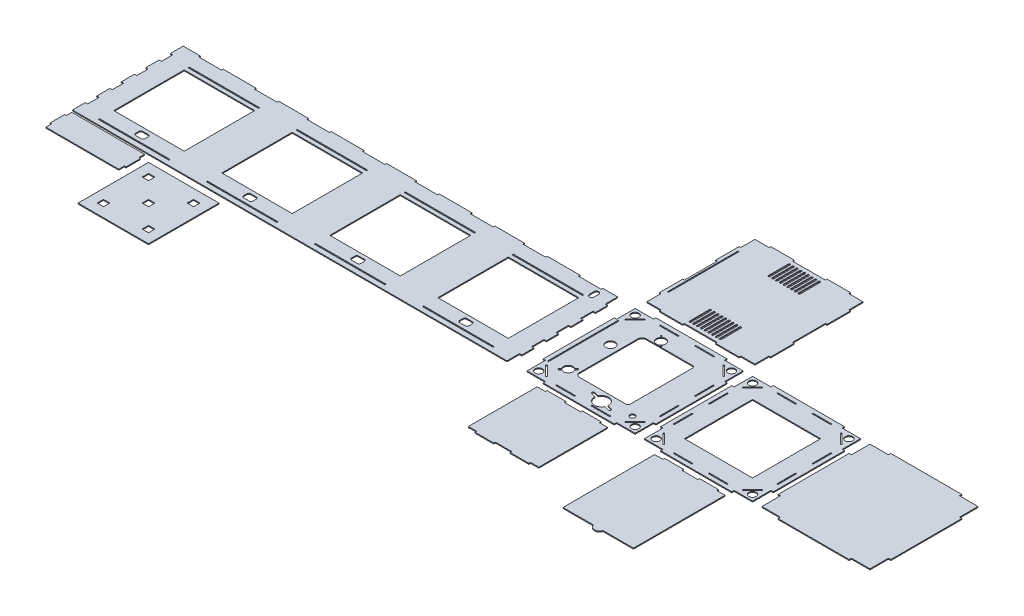
from build123d import *

# Parameters (mm, degrees)
BOSS_EXTRUDE1_DEPTH   = 2.54
SKETCH5_W             = 190.5
SKETCH5_H             = 3.302
SKETCH5_H_2           = 190.5
CUT_EXTRUDE2_DEPTH    = 752.643510473
BOSS_EXTRUDE2_DEPTH   = 2.54
SKETCH6_W             = 184.15
SKETCH6_H             = 184.15
BOSS_EXTRUDE2_2_DEPTH = 2.54
BOSS_EXTRUDE2_3_DEPTH = 2.54
BOSS_EXTRUDE3_DEPTH   = 2.54
SKETCH8_R             = 10
CUT_EXTRUDE3_DEPTH    = 1441.214067851
SKETCH9_W             = 190.5
SKETCH9_H             = 190.5
SKETCH9_W_2           = 17.272
SKETCH9_H_2           = 17.272
BOSS_EXTRUDE4_DEPTH   = 2.54
SKETCH11_R            = 12.6875032
SKETCH11_R_2          = 1.7054957
SKETCH11_R_3          = 6.747379022
CUT_EXTRUDE4_DEPTH    = 1468.277936465
SKETCH12_W            = 2.921
SKETCH12_H            = 50.8
SKETCH12_W_2          = 50.8
SKETCH12_H_2          = 2.921
CUT_EXTRUDE5_DEPTH    = 1468.277936465
SKETCH13_W            = 2.921
SKETCH13_H            = 190.5
CUT_EXTRUDE6_DEPTH    = 1468.277936465
BOSS_EXTRUDE5_DEPTH   = 2.54
SKETCH14_W            = 2.921
SKETCH14_H            = 190.5
BOSS_EXTRUDE5_2_DEPTH = 2.54
BOSS_EXTRUDE5_3_DEPTH = 2.54
SKETCH15_W            = 61.468
SKETCH15_H            = 4.445
CUT_EXTRUDE7_DEPTH    = 1500.410347645


with BuildPart() as part:
    # Sketch1 → Boss-Extrude1 (new body)
    with BuildSketch(Plane(origin=(0, 0, 0), x_dir=(1, 0, 0), z_dir=(0, 1, 0))):
        Polygon((146.05, 149.606), (438.15, 149.606), (438.15, 116.078), (444.5, 116.078), (444.5, 83.185), (438.15, 83.185), (438.15, 49.657), (444.5, 49.657), (444.5, 16.764), (438.15, 16.764), (438.15, -16.764), (444.5, -16.764), (444.5, -49.657), (438.15, -49.657), (438.15, -83.185), (444.5, -83.185), (444.5, -116.078), (438.15, -116.078), (438.15, -149.606), (146.05, -149.606), (-146.05, -149.606), (-438.15, -149.606), (-730.25, -149.606), (-736.6, -149.606), (-736.6, -114.8715), (-730.25, -114.8715), (-730.25, -84.3915), (-736.6, -84.3915), (-736.6, -48.4505), (-730.25, -48.4505), (-730.25, -17.9705), (-736.6, -17.9705), (-736.6, 17.9705), (-730.25, 17.9705), (-730.25, 48.4505), (-736.6, 48.4505), (-736.6, 84.3915), (-730.25, 84.3915), (-730.25, 114.8715), (-736.6, 114.8715), (-736.6, 149.606), (-730.25, 149.606), (-438.15, 149.606), (-146.05, 149.606), align=None)
    extrude(amount=BOSS_EXTRUDE1_DEPTH)

    # Sketch5 → Cut-Extrude2 (cut, through all)
    with BuildSketch(Plane(origin=(0, 2.54, 0), x_dir=(1, 0, 0), z_dir=(0, 1, 0))):
        with Locations((-584.2, -135.255)):
            Rectangle(SKETCH5_W, SKETCH5_H)
        with Locations((-292.1, -135.255)):
            Rectangle(SKETCH5_W, SKETCH5_H)
        with Locations((0, -135.255)):
            Rectangle(SKETCH5_W, SKETCH5_H)
        with Locations((292.1, -135.255)):
            Rectangle(SKETCH5_W, SKETCH5_H)
        with Locations((-584.2, 0)):
            Rectangle(SKETCH5_W, SKETCH5_H_2)
        with Locations((-292.1, 0)):
            Rectangle(SKETCH5_W, SKETCH5_H_2)
        Rectangle(SKETCH5_W, SKETCH5_H_2)
        with Locations((292.1, 0)):
            Rectangle(SKETCH5_W, SKETCH5_H_2)
        with Locations((-584.2, 107.061)):
            Rectangle(SKETCH5_W, SKETCH5_H)
        with Locations((-292.1, 107.061)):
            Rectangle(SKETCH5_W, SKETCH5_H)
        with Locations((0, 107.061)):
            Rectangle(SKETCH5_W, SKETCH5_H)
        with Locations((292.1, 107.061)):
            Rectangle(SKETCH5_W, SKETCH5_H)
        with BuildLine():
            Line((-7.62, -124.079), (7.62, -124.079))
            ThreePointArc((7.62, -124.079), (11.212102448, -122.591102448), (12.7, -118.999))
            Line((12.7, -118.999), (12.7, -109.855))
            ThreePointArc((12.7, -109.855), (11.212102448, -106.262897552), (7.62, -104.775))
            Line((7.62, -104.775), (-7.62, -104.775))
            ThreePointArc((-7.62, -104.775), (-11.212102448, -106.262897552), (-12.7, -109.855))
            Line((-12.7, -109.855), (-12.7, -118.999))
            ThreePointArc((-12.7, -118.999), (-11.212102448, -122.591102448), (-7.62, -124.079))
        make_face()
        with BuildLine():
            Line((-299.72, -104.775), (-284.48, -104.775))
            ThreePointArc((-284.48, -104.775), (-280.887897552, -106.262897552), (-279.4, -109.855))
            Line((-279.4, -109.855), (-279.4, -118.999))
            ThreePointArc((-279.4, -118.999), (-280.887897552, -122.591102448), (-284.48, -124.079))
            Line((-284.48, -124.079), (-299.72, -124.079))
            ThreePointArc((-299.72, -124.079), (-303.312102448, -122.591102448), (-304.8, -118.999))
            Line((-304.8, -118.999), (-304.8, -109.855))
            ThreePointArc((-304.8, -109.855), (-303.312102448, -106.262897552), (-299.72, -104.775))
        make_face()
        with BuildLine():
            Line((284.48, -124.079), (299.72, -124.079))
            ThreePointArc((299.72, -124.079), (303.312102448, -122.591102448), (304.8, -118.999))
            Line((304.8, -118.999), (304.8, -109.855))
            ThreePointArc((304.8, -109.855), (303.312102448, -106.262897552), (299.72, -104.775))
            Line((299.72, -104.775), (284.48, -104.775))
            ThreePointArc((284.48, -104.775), (280.887897552, -106.262897552), (279.4, -109.855))
            Line((279.4, -109.855), (279.4, -118.999))
            ThreePointArc((279.4, -118.999), (280.887897552, -122.591102448), (284.48, -124.079))
        make_face()
        with BuildLine():
            Line((-596.9, -109.855), (-596.9, -118.999))
            ThreePointArc((-596.9, -118.999), (-595.412102448, -122.591102448), (-591.82, -124.079))
            Line((-591.82, -124.079), (-576.58, -124.079))
            ThreePointArc((-576.58, -124.079), (-572.987897552, -122.591102448), (-571.5, -118.999))
            Line((-571.5, -118.999), (-571.5, -109.855))
            ThreePointArc((-571.5, -109.855), (-572.987897552, -106.262897552), (-576.58, -104.775))
            Line((-576.58, -104.775), (-591.82, -104.775))
            ThreePointArc((-591.82, -104.775), (-595.412102448, -106.262897552), (-596.9, -109.855))
        make_face()
        with BuildLine():
            Line((406.4, 130.302), (406.4, 117.602))
            ThreePointArc((406.4, 117.602), (400.05, 111.252), (393.7, 117.602))
            Line((393.7, 117.602), (393.7, 130.302))
            ThreePointArc((393.7, 130.302), (400.05, 136.652), (406.4, 130.302))
        make_face()
    extrude(amount=-CUT_EXTRUDE2_DEPTH, mode=Mode.SUBTRACT)

    # Sketch15 → Cut-Extrude7 (cut, through all)
    with BuildSketch(Plane(origin=(0, 2.54, 0), x_dir=(1, 0, 0), z_dir=(0, 1, 0))):
        with Locations((216.916, 147.3835)):
            Rectangle(SKETCH15_W, SKETCH15_H)
        with Locations((367.284, 147.3835)):
            Rectangle(SKETCH15_W, SKETCH15_H)
        with Locations((-75.184, 147.3835)):
            Rectangle(SKETCH15_W, SKETCH15_H)
        with Locations((75.184, 147.3835)):
            Rectangle(SKETCH15_W, SKETCH15_H)
        with Locations((-367.284, 147.3835)):
            Rectangle(SKETCH15_W, SKETCH15_H)
        with Locations((-216.916, 147.3835)):
            Rectangle(SKETCH15_W, SKETCH15_H)
        with Locations((-659.384, 147.3835)):
            Rectangle(SKETCH15_W, SKETCH15_H)
        with Locations((-509.016, 147.3835)):
            Rectangle(SKETCH15_W, SKETCH15_H)
    extrude(amount=-CUT_EXTRUDE7_DEPTH, mode=Mode.SUBTRACT)


with BuildPart() as body_2:
    # Sketch6 → Boss-Extrude2 (new body)
    with BuildSketch(Plane(origin=(0, 0, 0), x_dir=(1, 0, 0), z_dir=(0, 1, 0))):
        Polygon((488.95, 96.139), (488.95, 146.05), (538.861, 146.05), (538.861, 152.4), (731.139, 152.4), (731.139, 146.05), (781.05, 146.05), (781.05, 96.139), (787.4, 96.139), (787.4, -96.139), (781.05, -96.139), (781.05, -146.05), (731.139, -146.05), (731.139, -152.4), (538.861, -152.4), (538.861, -146.05), (488.95, -146.05), (488.95, -96.139), (482.6, -96.139), (482.6, 96.139), align=None)
    extrude(amount=BOSS_EXTRUDE2_DEPTH)


with BuildPart() as body_3:
    # Sketch6 → Boss-Extrude2 2 (new body)
    with BuildSketch(Plane(origin=(0, 0, 0), x_dir=(1, 0, 0), z_dir=(0, 1, 0))):
        Polygon((800.1, 96.139), (800.1, -96.139), (806.45, -96.139), (806.45, -146.05), (856.361, -146.05), (856.361, -152.4), (1048.639, -152.4), (1048.639, -146.05), (1098.55, -146.05), (1098.55, -96.139), (1104.9, -96.139), (1104.9, 96.139), (1098.55, 96.139), (1098.55, 146.05), (1048.639, 146.05), (1048.639, 152.4), (856.361, 152.4), (856.361, 146.05), (806.45, 146.05), (806.45, 96.139), align=None)
        with Locations((952.5, 0)):
            Rectangle(SKETCH6_W, SKETCH6_H, mode=Mode.SUBTRACT)
    extrude(amount=BOSS_EXTRUDE2_2_DEPTH)


with BuildPart() as body_4:
    # Sketch6 → Boss-Extrude2 3 (new body)
    with BuildSketch(Plane(origin=(0, 0, 0), x_dir=(1, 0, 0), z_dir=(0, 1, 0))):
        Polygon((1117.6, 96.139), (1117.6, -96.139), (1123.95, -96.139), (1123.95, -146.05), (1173.861, -146.05), (1173.861, -152.4), (1366.139, -152.4), (1366.139, -146.05), (1416.05, -146.05), (1416.05, -96.139), (1422.4, -96.139), (1422.4, 96.139), (1416.05, 96.139), (1416.05, 146.05), (1366.139, 146.05), (1366.139, 152.4), (1173.861, 152.4), (1173.861, 146.05), (1123.95, 146.05), (1123.95, 96.139), align=None)
    extrude(amount=BOSS_EXTRUDE2_3_DEPTH)


with BuildPart() as body_5:
    # Sketch7 → Boss-Extrude3 (new body)
    with BuildSketch(Plane(origin=(0, 0, 0), x_dir=(1, 0, 0), z_dir=(0, 1, 0))):
        Polygon((-732.155, -155.956), (-535.559, -155.956), (-535.559, -171.196), (-531.114, -171.196), (-531.114, -210.566), (-535.559, -210.566), (-535.559, -225.806), (-732.155, -225.806), (-732.155, -210.566), (-736.6, -210.566), (-736.6, -171.196), (-732.155, -171.196), align=None)
    extrude(amount=BOSS_EXTRUDE3_DEPTH)


with BuildPart() as cut_extrude3_tool:
    # Sketch8 → Cut-Extrude3 (new, through all)
    with BuildSketch(Plane(origin=(0, 2.54, 0), x_dir=(1, 0, 0), z_dir=(0, 1, 0))):
        with Locations((822.165448212, 130.334551788)):
            Circle(SKETCH8_R)
        with Locations((1082.834551788, 130.334551788)):
            Circle(SKETCH8_R)
        with Locations((1082.834551788, -130.334551788)):
            Circle(SKETCH8_R)
        with Locations((822.165448212, -130.334551788)):
            Circle(SKETCH8_R)
        with Locations((504.665448212, 130.334551788)):
            Circle(SKETCH8_R)
        with Locations((765.334551788, 130.334551788)):
            Circle(SKETCH8_R)
        with Locations((765.334551788, -130.334551788)):
            Circle(SKETCH8_R)
        with Locations((504.665448212, -130.334551788)):
            Circle(SKETCH8_R)
        Polygon((500.435115818, -107.624115818), (527.375884182, -134.564884182), (529.710750773, -132.23001759), (502.76998241, -105.289249227), align=None)
        Polygon((529.710750773, 132.23001759), (502.76998241, 105.289249227), (500.435115818, 107.624115818), (527.375884182, 134.564884182), align=None)
        Polygon((767.23001759, 105.289249227), (740.289249227, 132.23001759), (742.624115818, 134.564884182), (769.564884182, 107.624115818), align=None)
        Polygon((740.289249227, -132.23001759), (767.23001759, -105.289249227), (769.564884182, -107.624115818), (742.624115818, -134.564884182), align=None)
        Polygon((817.935115818, -107.624115818), (820.26998241, -105.289249227), (847.210750773, -132.23001759), (844.875884182, -134.564884182), align=None)
        Polygon((820.26998241, 105.289249227), (817.935115818, 107.624115818), (844.875884182, 134.564884182), (847.210750773, 132.23001759), align=None)
        Polygon((1057.789249227, 132.23001759), (1060.124115818, 134.564884182), (1087.064884182, 107.624115818), (1084.73001759, 105.289249227), align=None)
        Polygon((1084.73001759, -105.289249227), (1087.064884182, -107.624115818), (1060.124115818, -134.564884182), (1057.789249227, -132.23001759), align=None)
    extrude(amount=-CUT_EXTRUDE3_DEPTH)


with BuildPart() as body_2_1:
    add(body_2.part)

    # Cut-Extrude3: cut by cut_extrude3_tool
    add(cut_extrude3_tool.part, mode=Mode.SUBTRACT)

    # Sketch11 → Cut-Extrude4 (cut, through all)
    with BuildSketch(Plane(origin=(0, 2.54, 0), x_dir=(1, 0, 0), z_dir=(0, 1, 0))):
        with Locations((540.385, 28.067)):
            Circle(SKETCH11_R)
        with Locations((600.584397, 104.3237436)):
            Circle(SKETCH11_R)
        with Locations((612.380792, 93.3292393)):
            Circle(SKETCH11_R_2)
        with Locations((588.3905174, 117.3172406)):
            Circle(SKETCH11_R_2)
        with Locations((737.057200001, -109.220000002)):
            Circle(SKETCH11_R_3)
        with BuildLine():
            Line((679.001218905, -124.538259876), (690.502378135, -127.619986202))
            ThreePointArc((690.502378135, -127.619986202), (694.235400503, -125.464724733), (692.080139033, -121.731702364))
            Line((692.080139033, -121.731702364), (680.578979804, -118.649976037))
            ThreePointArc((680.578979804, -118.649976037), (679.882033046, -118.172215085), (679.639114424, -117.362906211))
            ThreePointArc((679.639114424, -117.362906211), (665.550382, -98.069523592), (643.702490503, -107.733716851))
            ThreePointArc((643.702490503, -107.733716851), (643.087462368, -108.313139585), (642.245008295, -108.378419327))
            Line((642.245008295, -108.378419327), (630.743849064, -105.296693))
            ThreePointArc((630.743849064, -105.296693), (627.010826696, -107.451954469), (629.166088165, -111.184976837))
            Line((629.166088165, -111.184976837), (640.667247395, -114.266703165))
            ThreePointArc((640.667247395, -114.266703165), (641.364194153, -114.744464117), (641.607112775, -115.553772991))
            ThreePointArc((641.607112775, -115.553772991), (652.618847339, -133.731389412), (673.606119056, -130.381992048))
            ThreePointArc((673.606119056, -130.381992048), (675.79922073, -127.952351108), (677.543736697, -125.182962351))
            ThreePointArc((677.543736697, -125.182962351), (678.158764831, -124.603539618), (679.001218905, -124.538259876))
        make_face()
        with BuildLine():
            Line((551.677072903, -78.533766145), (554.425437911, -75.785401137))
            ThreePointArc((554.425437911, -75.785401137), (554.425437911, -72.193298689), (550.833335463, -72.193298689))
            Line((550.833335463, -72.193298689), (548.084970455, -74.941663697))
            ThreePointArc((548.084970455, -74.941663697), (547.361951275, -75.30152232), (546.568159689, -75.15269396))
            ThreePointArc((546.568159689, -75.15269396), (531.414977451, -77.260920051), (529.30675136, -92.414102289))
            ThreePointArc((529.30675136, -92.414102289), (529.45557972, -93.207893875), (529.095721097, -93.930913055))
            Line((529.095721097, -93.930913055), (526.347356089, -96.679278063))
            ThreePointArc((526.347356089, -96.679278063), (526.347356089, -100.271380511), (529.939458537, -100.271380511))
            Line((529.939458537, -100.271380511), (532.687823545, -97.523015503))
            ThreePointArc((532.687823545, -97.523015503), (533.410842725, -97.16315688), (534.204634311, -97.31198524))
            ThreePointArc((534.204634311, -97.31198524), (549.357816549, -95.203759149), (551.46604264, -80.050576911))
            ThreePointArc((551.46604264, -80.050576911), (551.31721428, -79.256785325), (551.677072903, -78.533766145))
        make_face()
        with BuildLine():
            Line((699.863001735, 90.322743515), (574.863001758, 90.322743515))
            ThreePointArc((574.863001758, 90.322743515), (566.871456828, 87.01253722), (563.561250533, 79.02099229))
            Line((563.561250533, 79.02099229), (563.561250533, -78.979005984))
            ThreePointArc((563.561250533, -78.979005984), (566.871456828, -86.970550914), (574.863001758, -90.280757208))
            Line((574.863001758, -90.280757208), (699.863001735, -90.280757208))
            ThreePointArc((699.863001735, -90.280757208), (704.319011668, -88.435017459), (706.164751417, -83.979007526))
            Line((706.164751417, -83.979007526), (706.164751417, 84.020993832))
            ThreePointArc((706.164751417, 84.020993832), (704.319011668, 88.477003766), (699.863001735, 90.322743515))
        make_face()
    extrude(amount=-CUT_EXTRUDE4_DEPTH, mode=Mode.SUBTRACT)


with BuildPart() as body_3_1:
    add(body_3.part)

    # Cut-Extrude3: cut by cut_extrude3_tool
    add(cut_extrude3_tool.part, mode=Mode.SUBTRACT)


with BuildPart() as body_6:
    # Sketch9 → Boss-Extrude4 (new body)
    with BuildSketch(Plane(origin=(0, 0, 0), x_dir=(1, 0, 0), z_dir=(0, 1, 0))):
        with Locations((-415.864, -264.856)):
            Rectangle(SKETCH9_W, SKETCH9_H)
        with Locations((-415.864, -264.856)):
            Rectangle(SKETCH9_W_2, SKETCH9_H_2, mode=Mode.SUBTRACT)
        with Locations((-476.762727194, -203.957272806)):
            Rectangle(SKETCH9_W_2, SKETCH9_H_2, mode=Mode.SUBTRACT)
        with Locations((-476.762727194, -325.754727194)):
            Rectangle(SKETCH9_W_2, SKETCH9_H_2, mode=Mode.SUBTRACT)
        with Locations((-354.965272806, -325.754727194)):
            Rectangle(SKETCH9_W_2, SKETCH9_H_2, mode=Mode.SUBTRACT)
        with Locations((-354.965272806, -203.957272806)):
            Rectangle(SKETCH9_W_2, SKETCH9_H_2, mode=Mode.SUBTRACT)
    extrude(amount=BOSS_EXTRUDE4_DEPTH)


with BuildPart() as cut_extrude5_tool:
    # Sketch12 → Cut-Extrude5 (new, through all)
    with BuildSketch(Plane(origin=(0, 2.54, 0), x_dir=(1, 0, 0), z_dir=(0, 1, 0))):
        with Locations((494.8555, -47.621822164)):
            Rectangle(SKETCH12_W, SKETCH12_H)
        with Locations((494.8555, 47.628177836)):
            Rectangle(SKETCH12_W, SKETCH12_H)
        with Locations((682.628177836, 140.1445)):
            Rectangle(SKETCH12_W_2, SKETCH12_H_2)
        with Locations((587.378177836, 140.1445)):
            Rectangle(SKETCH12_W_2, SKETCH12_H_2)
        with Locations((775.1445, -47.628177836)):
            Rectangle(SKETCH12_W, SKETCH12_H)
        with Locations((775.1445, 47.621822164)):
            Rectangle(SKETCH12_W, SKETCH12_H)
        with Locations((587.371822164, -140.1445)):
            Rectangle(SKETCH12_W_2, SKETCH12_H_2)
        with Locations((682.621822164, -140.1445)):
            Rectangle(SKETCH12_W_2, SKETCH12_H_2)
        with Locations((812.3555, 47.628177836)):
            Rectangle(SKETCH12_W, SKETCH12_H)
        with Locations((812.3555, -47.621822164)):
            Rectangle(SKETCH12_W, SKETCH12_H)
        with Locations((1000.128177836, 140.1445)):
            Rectangle(SKETCH12_W_2, SKETCH12_H_2)
        with Locations((904.878177836, 140.1445)):
            Rectangle(SKETCH12_W_2, SKETCH12_H_2)
        with Locations((1092.6445, -47.628177836)):
            Rectangle(SKETCH12_W, SKETCH12_H)
        with Locations((1092.6445, 47.621822164)):
            Rectangle(SKETCH12_W, SKETCH12_H)
        with Locations((904.871822164, -140.1445)):
            Rectangle(SKETCH12_W_2, SKETCH12_H_2)
        with Locations((1000.121822164, -140.1445)):
            Rectangle(SKETCH12_W_2, SKETCH12_H_2)
    extrude(amount=-CUT_EXTRUDE5_DEPTH)


with BuildPart() as body_2_2:
    add(body_2_1.part)

    # Cut-Extrude5: cut by cut_extrude5_tool
    add(cut_extrude5_tool.part, mode=Mode.SUBTRACT)

    # Sketch13 → Cut-Extrude6 (cut, through all)
    with BuildSketch(Plane(origin=(0, 2.54, 0), x_dir=(1, 0, 0), z_dir=(0, 1, 0))):
        with Locations((494.8555, 0.003177836)):
            Rectangle(SKETCH13_W, SKETCH13_H)
    extrude(amount=-CUT_EXTRUDE6_DEPTH, mode=Mode.SUBTRACT)


with BuildPart() as body_3_2:
    add(body_3_1.part)

    # Cut-Extrude5: cut by cut_extrude5_tool
    add(cut_extrude5_tool.part, mode=Mode.SUBTRACT)


with BuildPart() as body_7:
    # Sketch14 → Boss-Extrude5 (new body)
    with BuildSketch(Plane(origin=(0, 0, 0), x_dir=(1, 0, 0), z_dir=(0, 1, 0))):
        Polygon((539.746822164, -169.545), (561.971822164, -169.545), (561.971822164, -165.1), (612.771822164, -165.1), (612.771822164, -169.545), (657.221822164, -169.545), (657.221822164, -165.1), (708.021822164, -165.1), (708.021822164, -169.545), (730.246822164, -169.545), (730.246822164, -355.6), (708.021822164, -355.6), (708.021822164, -360.045), (657.221822164, -360.045), (657.221822164, -355.6), (612.771822164, -355.6), (612.771822164, -360.045), (561.971822164, -360.045), (561.971822164, -355.6), (539.746822164, -355.6), align=None)
    extrude(amount=BOSS_EXTRUDE5_DEPTH)


with BuildPart() as body_8:
    # Sketch14 → Boss-Extrude5 2 (new body)
    with BuildSketch(Plane(origin=(0, 0, 0), x_dir=(1, 0, 0), z_dir=(0, 1, 0))):
        Polygon((488.95, 469.9), (527.05, 469.9), (527.05, 474.345), (590.55, 474.345), (590.55, 469.9), (679.45, 469.9), (679.45, 474.345), (742.95, 474.345), (742.95, 469.9), (781.05, 469.9), (781.05, 431.8), (785.495, 431.8), (785.495, 368.3), (781.05, 368.3), (781.05, 279.4), (785.495, 279.4), (785.495, 215.9), (781.05, 215.9), (781.05, 177.8), (742.95, 177.8), (742.95, 173.355), (679.45, 173.355), (679.45, 177.8), (590.55, 177.8), (590.55, 173.355), (527.05, 173.355), (527.05, 177.8), (488.95, 177.8), (488.95, 215.9), (484.505, 215.9), (484.505, 279.4), (488.95, 279.4), (488.95, 368.3), (484.505, 368.3), (484.505, 431.8), (488.95, 431.8), align=None)
        with BuildLine():
            Line((632.46, 244.1448), (632.46, 190.1698))
            ThreePointArc((632.46, 190.1698), (635, 187.6298), (637.54, 190.1698))
            Line((637.54, 190.1698), (637.54, 244.1448))
            ThreePointArc((637.54, 244.1448), (635, 246.6848), (632.46, 244.1448))
        make_face(mode=Mode.SUBTRACT)
        with BuildLine():
            Line((632.46, 403.5552), (632.46, 457.5302))
            ThreePointArc((632.46, 457.5302), (635, 460.0702), (637.54, 457.5302))
            Line((637.54, 457.5302), (637.54, 403.5552))
            ThreePointArc((637.54, 403.5552), (635, 401.0152), (632.46, 403.5552))
        make_face(mode=Mode.SUBTRACT)
        with BuildLine():
            Line((642.62, 403.5552), (642.62, 457.5302))
            ThreePointArc((642.62, 457.5302), (645.16, 460.0702), (647.7, 457.5302))
            Line((647.7, 457.5302), (647.7, 403.5552))
            ThreePointArc((647.7, 403.5552), (645.16, 401.0152), (642.62, 403.5552))
        make_face(mode=Mode.SUBTRACT)
        with BuildLine():
            Line((642.62, 244.1448), (642.62, 190.1698))
            ThreePointArc((642.62, 190.1698), (645.16, 187.6298), (647.7, 190.1698))
            Line((647.7, 190.1698), (647.7, 244.1448))
            ThreePointArc((647.7, 244.1448), (645.16, 246.6848), (642.62, 244.1448))
        make_face(mode=Mode.SUBTRACT)
        with BuildLine():
            Line((652.78, 403.5552), (652.78, 457.5302))
            ThreePointArc((652.78, 457.5302), (655.32, 460.0702), (657.86, 457.5302))
            Line((657.86, 457.5302), (657.86, 403.5552))
            ThreePointArc((657.86, 403.5552), (655.32, 401.0152), (652.78, 403.5552))
        make_face(mode=Mode.SUBTRACT)
        with BuildLine():
            Line((652.78, 244.1448), (652.78, 190.1698))
            ThreePointArc((652.78, 190.1698), (655.32, 187.6298), (657.86, 190.1698))
            Line((657.86, 190.1698), (657.86, 244.1448))
            ThreePointArc((657.86, 244.1448), (655.32, 246.6848), (652.78, 244.1448))
        make_face(mode=Mode.SUBTRACT)
        with BuildLine():
            Line((662.94, 403.5552), (662.94, 457.5302))
            ThreePointArc((662.94, 457.5302), (665.48, 460.0702), (668.02, 457.5302))
            Line((668.02, 457.5302), (668.02, 403.5552))
            ThreePointArc((668.02, 403.5552), (665.48, 401.0152), (662.94, 403.5552))
        make_face(mode=Mode.SUBTRACT)
        with BuildLine():
            Line((662.94, 244.1448), (662.94, 190.1698))
            ThreePointArc((662.94, 190.1698), (665.48, 187.6298), (668.02, 190.1698))
            Line((668.02, 190.1698), (668.02, 244.1448))
            ThreePointArc((668.02, 244.1448), (665.48, 246.6848), (662.94, 244.1448))
        make_face(mode=Mode.SUBTRACT)
        with BuildLine():
            Line((673.1, 403.5552), (673.1, 457.5302))
            ThreePointArc((673.1, 457.5302), (675.64, 460.0702), (678.18, 457.5302))
            Line((678.18, 457.5302), (678.18, 403.5552))
            ThreePointArc((678.18, 403.5552), (675.64, 401.0152), (673.1, 403.5552))
        make_face(mode=Mode.SUBTRACT)
        with BuildLine():
            Line((673.1, 244.1448), (673.1, 190.1698))
            ThreePointArc((673.1, 190.1698), (675.64, 187.6298), (678.18, 190.1698))
            Line((678.18, 190.1698), (678.18, 244.1448))
            ThreePointArc((678.18, 244.1448), (675.64, 246.6848), (673.1, 244.1448))
        make_face(mode=Mode.SUBTRACT)
        with BuildLine():
            Line((622.3, 403.5552), (622.3, 457.5302))
            ThreePointArc((622.3, 457.5302), (624.84, 460.0702), (627.38, 457.5302))
            Line((627.38, 457.5302), (627.38, 403.5552))
            ThreePointArc((627.38, 403.5552), (624.84, 401.0152), (622.3, 403.5552))
        make_face(mode=Mode.SUBTRACT)
        with BuildLine():
            Line((622.3, 244.1448), (622.3, 190.1698))
            ThreePointArc((622.3, 190.1698), (624.84, 187.6298), (627.38, 190.1698))
            Line((627.38, 190.1698), (627.38, 244.1448))
            ThreePointArc((627.38, 244.1448), (624.84, 246.6848), (622.3, 244.1448))
        make_face(mode=Mode.SUBTRACT)
        with BuildLine():
            Line((612.14, 403.5552), (612.14, 457.5302))
            ThreePointArc((612.14, 457.5302), (614.68, 460.0702), (617.22, 457.5302))
            Line((617.22, 457.5302), (617.22, 403.5552))
            ThreePointArc((617.22, 403.5552), (614.68, 401.0152), (612.14, 403.5552))
        make_face(mode=Mode.SUBTRACT)
        with BuildLine():
            Line((612.14, 244.1448), (612.14, 190.1698))
            ThreePointArc((612.14, 190.1698), (614.68, 187.6298), (617.22, 190.1698))
            Line((617.22, 190.1698), (617.22, 244.1448))
            ThreePointArc((617.22, 244.1448), (614.68, 246.6848), (612.14, 244.1448))
        make_face(mode=Mode.SUBTRACT)
        with BuildLine():
            Line((601.98, 403.5552), (601.98, 457.5302))
            ThreePointArc((601.98, 457.5302), (604.52, 460.0702), (607.06, 457.5302))
            Line((607.06, 457.5302), (607.06, 403.5552))
            ThreePointArc((607.06, 403.5552), (604.52, 401.0152), (601.98, 403.5552))
        make_face(mode=Mode.SUBTRACT)
        with BuildLine():
            Line((601.98, 244.1448), (601.98, 190.1698))
            ThreePointArc((601.98, 190.1698), (604.52, 187.6298), (607.06, 190.1698))
            Line((607.06, 190.1698), (607.06, 244.1448))
            ThreePointArc((607.06, 244.1448), (604.52, 246.6848), (601.98, 244.1448))
        make_face(mode=Mode.SUBTRACT)
        with BuildLine():
            Line((591.82, 403.5552), (591.82, 457.5302))
            ThreePointArc((591.82, 457.5302), (594.36, 460.0702), (596.9, 457.5302))
            Line((596.9, 457.5302), (596.9, 403.5552))
            ThreePointArc((596.9, 403.5552), (594.36, 401.0152), (591.82, 403.5552))
        make_face(mode=Mode.SUBTRACT)
        with BuildLine():
            Line((591.82, 244.1448), (591.82, 190.1698))
            ThreePointArc((591.82, 190.1698), (594.36, 187.6298), (596.9, 190.1698))
            Line((596.9, 190.1698), (596.9, 244.1448))
            ThreePointArc((596.9, 244.1448), (594.36, 246.6848), (591.82, 244.1448))
        make_face(mode=Mode.SUBTRACT)
        with Locations((494.8555, 323.85)):
            Rectangle(SKETCH14_W, SKETCH14_H, mode=Mode.SUBTRACT)
    extrude(amount=BOSS_EXTRUDE5_2_DEPTH)


with BuildPart() as body_9:
    # Sketch14 → Boss-Extrude5 3 (new body)
    with BuildSketch(Plane(origin=(0, 0, 0), x_dir=(1, 0, 0), z_dir=(0, 1, 0))):
        with BuildLine():
            Line((857.25, -169.545), (879.471822164, -169.545))
            Line((879.471822164, -169.545), (879.471822164, -165.1))
            Line((879.471822164, -165.1), (930.271822164, -165.1))
            Line((930.271822164, -165.1), (930.271822164, -169.545))
            Line((930.271822164, -169.545), (974.721822164, -169.545))
            Line((974.721822164, -169.545), (974.721822164, -165.1))
            Line((974.721822164, -165.1), (1025.521822164, -165.1))
            Line((1025.521822164, -165.1), (1025.521822164, -169.545))
            Line((1025.521822164, -169.545), (1047.75, -169.545))
            Line((1047.75, -169.545), (1047.75, -417.195))
            Line((1047.75, -417.195), (965.2, -417.195))
            ThreePointArc((965.2, -417.195), (952.5, -427.023458995), (939.8, -417.195))
            Line((939.8, -417.195), (857.25, -417.195))
            Line((857.25, -417.195), (857.25, -169.545))
        make_face()
    extrude(amount=BOSS_EXTRUDE5_3_DEPTH)


solid = Compound([part.part, body_4.part, body_5.part, body_6.part, body_2_2.part, body_3_2.part, body_7.part, body_8.part, body_9.part])
